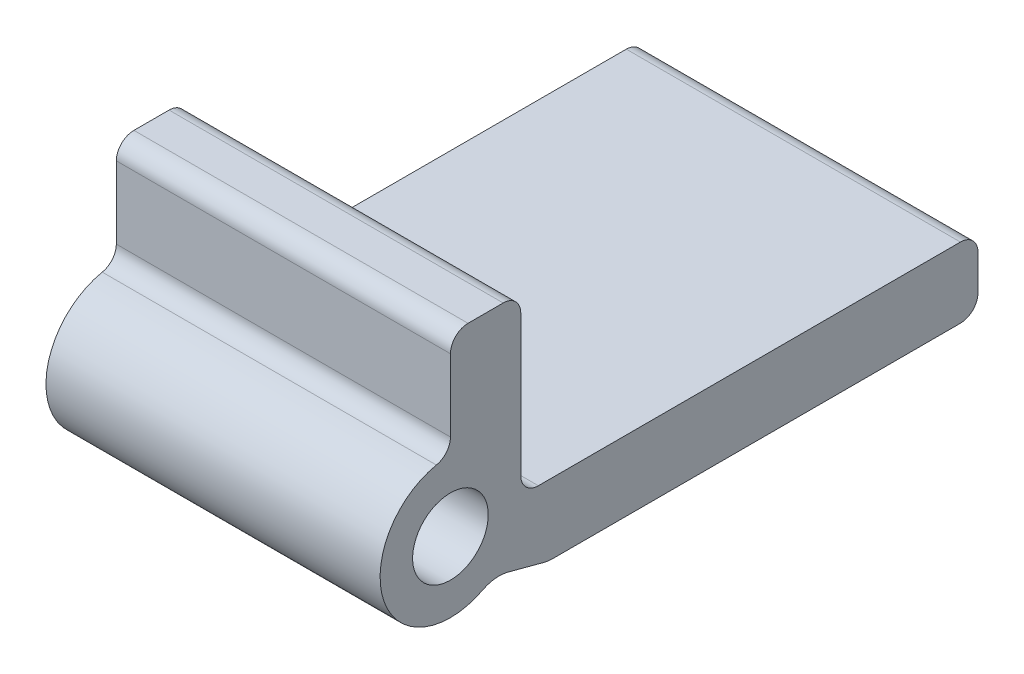
from build123d import *

# Parameters (mm, degrees)
SKETCH1_R           = 2.15
BOSS_EXTRUDE1_DEPTH = 9.5
FILLET1_R           = 2
FILLET2_R           = 1


with BuildPart() as part:
    # Sketch1 → Boss-Extrude1 (new, symmetric)
    with BuildSketch(Plane(origin=(0, 0, 0), x_dir=(0, 0, -1), z_dir=(1, 0, 0))):
        with BuildLine():
            Line((2.440170313, -3.169474538), (5.553949343, -4))
            Line((5.553949343, -4), (30, -4))
            Line((30, -4), (30, 0))
            Line((30, 0), (4, 0))
            Line((4, 0), (4, 10))
            Line((4, 10), (0, 10))
            Line((0, 10), (0, 4))
            ThreePointArc((0, 4), (-3.786680482, -1.288817646), (2.440170313, -3.169474538))
        make_face()
        Circle(SKETCH1_R, mode=Mode.SUBTRACT)
    extrude(amount=BOSS_EXTRUDE1_DEPTH, both=True)

    # Fillet1
    fillet1_edges = [part.edges().sort_by_distance(p)[0] for p in [
        (0, -4, -5.553949343),
        (0, -3.169474538, -2.440170313),
    ]]
    fillet(fillet1_edges, radius=FILLET1_R)

    # Fillet2
    fillet2_edges = [part.edges().sort_by_distance(p)[0] for p in [
        (0, -4, -30),
        (0, 0, -30),
        (0, 10, -4),
        (0, 10, 0),
        (0, 4, 0),
        (0, 0, -4),
    ]]
    fillet(fillet2_edges, radius=FILLET2_R)


solid = part.part
